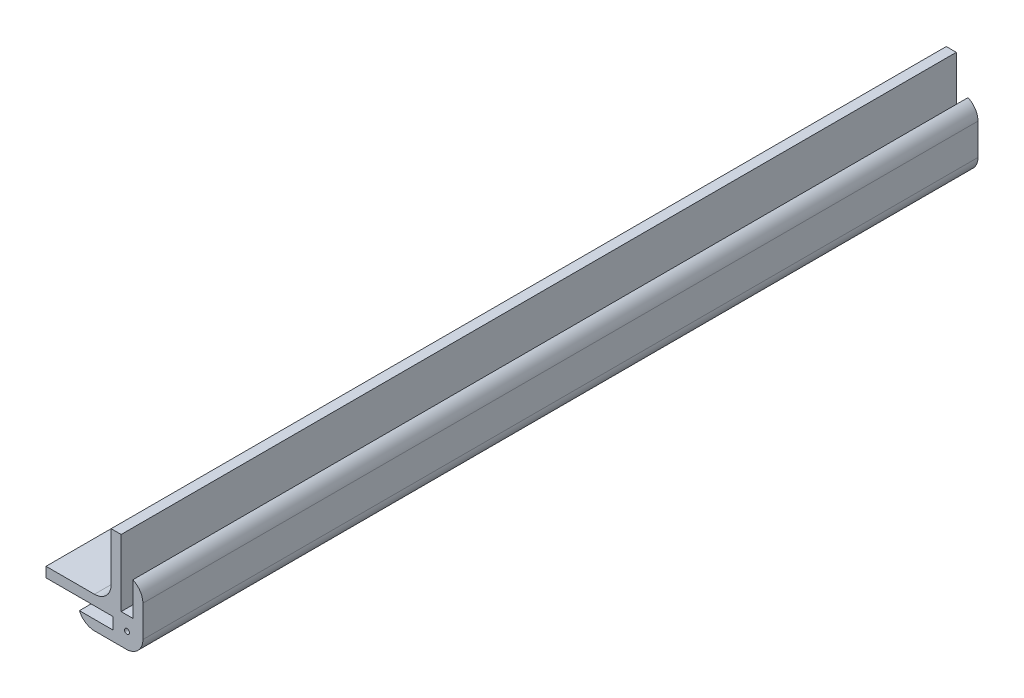
from build123d import *

# Parameters (mm, degrees)
BOSS_EXTRUDE1_DEPTH = 250
FILLET1_R           = 5
SKETCH4_R           = 0.75
CUT_EXTRUDE1_DEPTH  = 20
CUT_EXTRUDE2_START  = -20
SKETCH5_R           = 0.75
CUT_EXTRUDE2_DEPTH  = 20


with BuildPart() as part:
    # Sketch1 → Boss-Extrude1 (new body)
    with BuildSketch(Plane.XY):
        Polygon((0, 0), (0, 16), (-3, 16), (-3, 6), (-6.5, 6), (-6.5, 26), (-9.5, 26), (-9.5, 6.5), (-29, 6.5), (-29, 3.5), (-9, 3.5), (-9, 0), (-19, 0), (-19, -3), (0, -3), align=None)
    extrude(amount=BOSS_EXTRUDE1_DEPTH)

    # Fillet1
    # the kernel refuses this fillet: 5 mm, written as the material it adds along each edge
    with BuildSketch(Plane(origin=(-9.5, 6.5, 0), x_dir=(-1, 0, 0), z_dir=(0, 0, 1))) as fillet1_piece_1:
        with BuildLine():
            CenterArc((FILLET1_R, -FILLET1_R), FILLET1_R, 90, 90)
            Line((0, -FILLET1_R), (0, 0))
            Line((0, 0), (FILLET1_R, 0))
        make_face()
    extrude(amount=250)
    # the kernel refuses this fillet: 5 mm, written as the material it takes off along each edge
    with BuildSketch(Plane(origin=(-19, -3, -11.456439237), x_dir=(1, 0, 0), z_dir=(0, 0, 1))) as fillet1_2_piece_1:
        with BuildLine():
            CenterArc((4.582575695, 5), FILLET1_R, 203.578178478, 66.421821522)
            Line((0, 3), (0, 0))
            Line((0, 0), (4.582575695, 0))
        make_face()
    extrude(amount=272.912878475, mode=Mode.SUBTRACT)
    with BuildSketch(Plane(origin=(0, -3, -12.5), x_dir=(0, 1, 0), z_dir=(0, 0, 1))) as fillet1_2_piece_2:
        with BuildLine():
            CenterArc((FILLET1_R, FILLET1_R), FILLET1_R, 180, 90)
            Line((0, FILLET1_R), (0, 0))
            Line((0, 0), (FILLET1_R, 0))
        make_face()
    extrude(amount=275, mode=Mode.SUBTRACT)
    with BuildSketch(Plane(origin=(0, 16, -11.456439237), x_dir=(0, -1, 0), z_dir=(0, 0, 1))) as fillet1_2_piece_3:
        with BuildLine():
            CenterArc((4.582575695, -5), FILLET1_R, 90, 66.421821522)
            Line((0, -3), (0, 0))
            Line((0, 0), (4.582575695, 0))
        make_face()
    extrude(amount=272.912878475, mode=Mode.SUBTRACT)

    # Sketch4 → Cut-Extrude1 (cut)
    with BuildSketch(Plane(origin=(0, 0, 0), x_dir=(-1, 0, 0), z_dir=(0, 0, -1))):
        with Locations((4.75, 1.75)):
            Circle(SKETCH4_R)
    extrude(amount=-CUT_EXTRUDE1_DEPTH, mode=Mode.SUBTRACT)

    # Sketch5 → Cut-Extrude2 (cut)
    with BuildSketch(Plane.XY.offset(250).offset(CUT_EXTRUDE2_START)):
        with Locations(Location((-4.75, 1.75, 0), (0, 0, 180))):
            Circle(SKETCH5_R)
    extrude(amount=CUT_EXTRUDE2_DEPTH, mode=Mode.SUBTRACT)


solid = part.part
